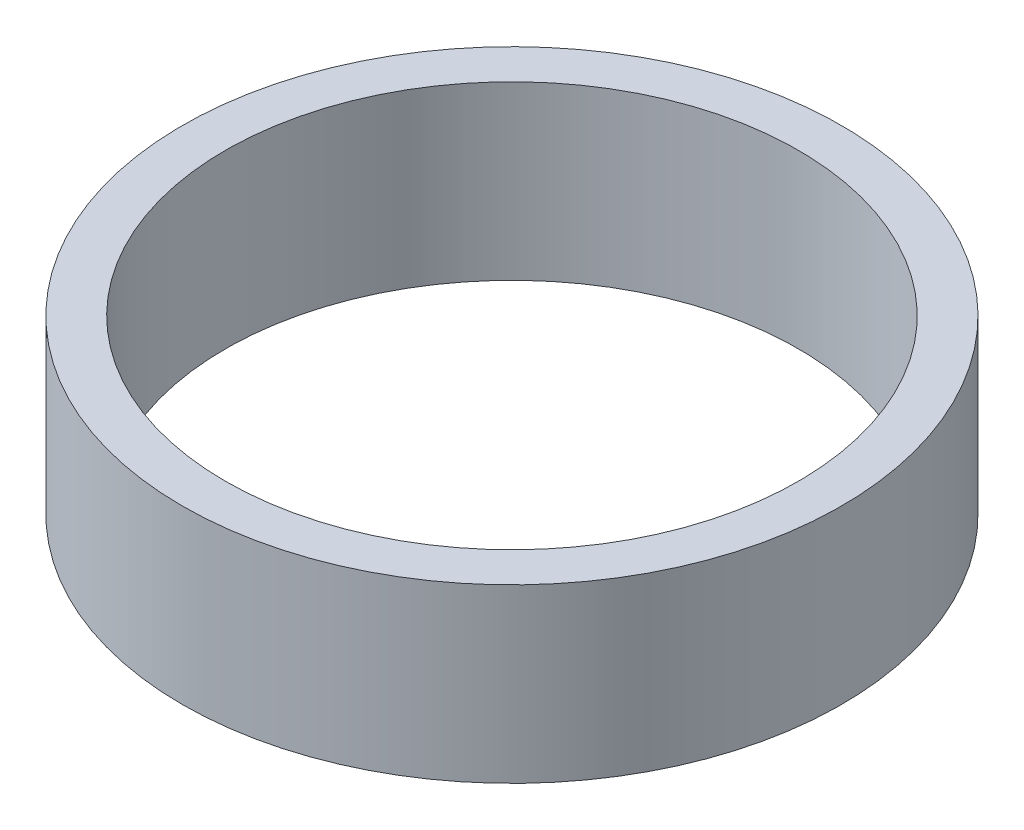
from build123d import *

# Parameters (mm, degrees)
SKETCH1_R           = 57.5
BOSS_EXTRUDE1_DEPTH = 30
SKETCH2_R           = 50
CUT_EXTRUDE1_DEPTH  = 87.674679117


with BuildPart() as part:
    # Sketch1 → Boss-Extrude1 (new body)
    with BuildSketch(Plane(origin=(0, 0, 0), x_dir=(1, 0, 0), z_dir=(0, 1, 0))):
        Circle(SKETCH1_R)
    extrude(amount=BOSS_EXTRUDE1_DEPTH)

    # Sketch2 → Cut-Extrude1 (cut, through all)
    with BuildSketch(Plane(origin=(0, 0, 0), x_dir=(1, 0, 0), z_dir=(0, 1, 0))):
        Circle(SKETCH2_R)
    extrude(amount=CUT_EXTRUDE1_DEPTH, mode=Mode.SUBTRACT)


solid = part.part
